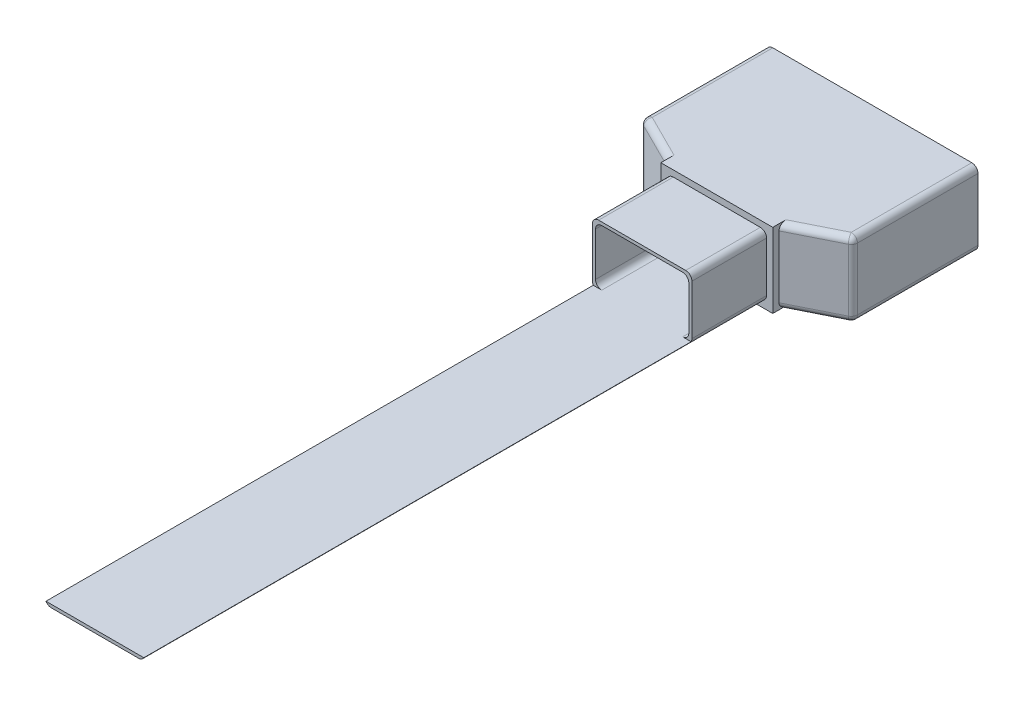
from build123d import *

# Parameters (mm, degrees)
CUT_EXTRUDE1_START         = -1.5875
CUT_EXTRUDE1_OUTLINE_W     = 53.975
CUT_EXTRUDE1_OUTLINE_H     = 19.05
CUT_EXTRUDE1_OUTLINE_W_2   = 50.8
CUT_EXTRUDE1_OUTLINE_H_2   = 15.875
CUT_EXTRUDE1_DEPTH         = 38.1
CUT_EXTRUDE1_START_2       = 30.1625
CUT_EXTRUDE1_2_DEPTH       = 166.6875
CUT_EXTRUDE1_3_DEPTH       = 6.35
CUT_EXTRUDE1_4_OUTLINE_W   = 50.8
CUT_EXTRUDE1_4_OUTLINE_H   = 15.875
CUT_EXTRUDE1_4_OUTLINE_W_2 = 7.9375
CUT_EXTRUDE1_4_OUTLINE_H_2 = 12.7
CUT_EXTRUDE1_4_DEPTH       = 1.5875
CUT_EXTRUDE1_5_DEPTH       = 26.9875
CUT_EXTRUDE1_6_OUTLINE_W   = 28.575
CUT_EXTRUDE1_6_OUTLINE_H   = 19.05
CUT_EXTRUDE1_6_DEPTH       = 7.9375
CUT_EXTRUDE1_START_3       = 2.38125
CUT_EXTRUDE1_7_DEPTH       = 14.2875
CUT_EXTRUDE1_8_DEPTH       = 19.05
SKETCH2_W                  = 8.89
SKETCH2_H                  = 2.5908
CUT_EXTRUDE2_DEPTH         = 203.030816028
SKETCH3_W                  = 1.9812
SKETCH3_H                  = 2.9972
CUT_EXTRUDE3_DEPTH         = 203.030816028
FILLET1_R                  = 1.5875
HOLE1_D                    = 6.35
HOLE1_DEPTH                = 1.5875


with BuildPart() as part:
    # Cut-Extrude1: read off the stored shape, not the designer's step
    # Cut-Extrude1 outline → Cut-Extrude1 (new body)
    with BuildSketch(Plane.XY.offset(-36.5125).offset(CUT_EXTRUDE1_START)):
        with Locations((14.2875, 9.525)):
            Rectangle(CUT_EXTRUDE1_OUTLINE_W, CUT_EXTRUDE1_OUTLINE_H)
        with Locations((14.2875, 9.525)):
            Rectangle(CUT_EXTRUDE1_OUTLINE_W_2, CUT_EXTRUDE1_OUTLINE_H_2, mode=Mode.SUBTRACT)
    extrude(amount=CUT_EXTRUDE1_DEPTH)

    # Cut-Extrude1 2 outline → Cut-Extrude1 2 (add)
    with BuildSketch(Plane.XY.offset(-36.5125).offset(CUT_EXTRUDE1_START_2)):
        with BuildLine():
            Line((3.175, 1.5875), (25.4, 1.5875))
            ThreePointArc((25.4, 1.5875), (26.19375, 1.800184672), (26.774815328, 2.38125))
            Line((26.774815328, 2.38125), (1.800184672, 2.38125))
            ThreePointArc((1.800184672, 2.38125), (2.38125, 1.800184672), (3.175, 1.5875))
        make_face()
    extrude(amount=CUT_EXTRUDE1_2_DEPTH)

    # Cut-Extrude1 3 outline → Cut-Extrude1 3 (add)
    with BuildSketch(Plane.XY.offset(-36.5125).offset(CUT_EXTRUDE1_START_2)):
        with BuildLine():
            Line((25.4, 1.5875), (39.6875, 1.5875))
            Line((39.6875, 1.5875), (39.6875, 17.4625))
            Line((39.6875, 17.4625), (-11.1125, 17.4625))
            Line((-11.1125, 17.4625), (-11.1125, 1.5875))
            Line((-11.1125, 1.5875), (3.175, 1.5875))
            ThreePointArc((3.175, 1.5875), (2.38125, 1.800184672), (1.800184672, 2.38125))
            Line((1.800184672, 2.38125), (3.96875, 2.38125))
            ThreePointArc((3.96875, 2.38125), (2.846217985, 2.846217985), (2.38125, 3.96875))
            Line((2.38125, 3.96875), (2.38125, 15.08125))
            ThreePointArc((2.38125, 15.08125), (2.846217985, 16.203782015), (3.96875, 16.66875))
            Line((3.96875, 16.66875), (24.60625, 16.66875))
            ThreePointArc((24.60625, 16.66875), (25.728782015, 16.203782015), (26.19375, 15.08125))
            Line((26.19375, 15.08125), (26.19375, 3.96875))
            ThreePointArc((26.19375, 3.96875), (25.728782015, 2.846217985), (24.60625, 2.38125))
            Line((24.60625, 2.38125), (26.774815328, 2.38125))
            ThreePointArc((26.774815328, 2.38125), (26.19375, 1.800184672), (25.4, 1.5875))
        make_face()
    extrude(amount=CUT_EXTRUDE1_3_DEPTH)

    # Cut-Extrude1 4 outline → Cut-Extrude1 4 (add)
    with BuildSketch(Plane.XY.offset(-36.5125).offset(CUT_EXTRUDE1_START)):
        with Locations((14.2875, 9.525)):
            Rectangle(CUT_EXTRUDE1_4_OUTLINE_W, CUT_EXTRUDE1_4_OUTLINE_H)
        with Locations((30.1625, 9.525)):
            Rectangle(CUT_EXTRUDE1_4_OUTLINE_W_2, CUT_EXTRUDE1_4_OUTLINE_H_2, mode=Mode.SUBTRACT)
    extrude(amount=CUT_EXTRUDE1_4_DEPTH)

    # Cut-Extrude1 5 outline → Cut-Extrude1 5 (add)
    with BuildSketch(Plane.XY.offset(-36.5125).offset(CUT_EXTRUDE1_START_2)):
        with BuildLine():
            Line((25.4, 17.4625), (3.175, 17.4625))
            ThreePointArc((3.175, 17.4625), (2.052467985, 16.997532015), (1.5875, 15.875))
            Line((1.5875, 15.875), (1.5875, 3.175))
            ThreePointArc((1.5875, 3.175), (1.641592751, 2.764124766), (1.800184672, 2.38125))
            Line((1.800184672, 2.38125), (3.96875, 2.38125))
            ThreePointArc((3.96875, 2.38125), (2.846217985, 2.846217985), (2.38125, 3.96875))
            Line((2.38125, 3.96875), (2.38125, 15.08125))
            ThreePointArc((2.38125, 15.08125), (2.846217985, 16.203782015), (3.96875, 16.66875))
            Line((3.96875, 16.66875), (24.60625, 16.66875))
            ThreePointArc((24.60625, 16.66875), (25.728782015, 16.203782015), (26.19375, 15.08125))
            Line((26.19375, 15.08125), (26.19375, 3.96875))
            ThreePointArc((26.19375, 3.96875), (25.728782015, 2.846217985), (24.60625, 2.38125))
            Line((24.60625, 2.38125), (26.774815328, 2.38125))
            ThreePointArc((26.774815328, 2.38125), (26.933407249, 2.764124766), (26.9875, 3.175))
            Line((26.9875, 3.175), (26.9875, 15.875))
            ThreePointArc((26.9875, 15.875), (26.522532015, 16.997532015), (25.4, 17.4625))
        make_face()
    extrude(amount=CUT_EXTRUDE1_5_DEPTH)

    # Cut-Extrude1 6 outline → Cut-Extrude1 6 (add)
    with BuildSketch(Plane.XY.offset(-36.5125).offset(CUT_EXTRUDE1_START_2)):
        with Locations((14.2875, 9.525)):
            Rectangle(CUT_EXTRUDE1_6_OUTLINE_W, CUT_EXTRUDE1_6_OUTLINE_H)
        with BuildLine():
            Line((25.4, 1.5875), (3.175, 1.5875))
            ThreePointArc((3.175, 1.5875), (2.052467985, 2.052467985), (1.5875, 3.175))
            Line((1.5875, 3.175), (1.5875, 15.875))
            ThreePointArc((1.5875, 15.875), (2.052467985, 16.997532015), (3.175, 17.4625))
            Line((3.175, 17.4625), (25.4, 17.4625))
            ThreePointArc((25.4, 17.4625), (26.522532015, 16.997532015), (26.9875, 15.875))
            Line((26.9875, 15.875), (26.9875, 3.175))
            ThreePointArc((26.9875, 3.175), (26.522532015, 2.052467985), (25.4, 1.5875))
        make_face(mode=Mode.SUBTRACT)
    extrude(amount=CUT_EXTRUDE1_6_DEPTH)

    # Cut-Extrude1 7 outline → Cut-Extrude1 7 (cut)
    with BuildSketch(Plane(origin=(0, 0, 0), x_dir=(1, 0, 0), z_dir=(0, 1, 0)).offset(CUT_EXTRUDE1_START_3)):
        Polygon((41.275, 6.35), (28.575, 0), (41.275, 0), align=None)
        Polygon((38.89375, 6.35), (-10.31875, 6.35), (6.38125, -2), (22.19375, -2), align=None)
        Polygon((0, 0), (-12.7, 6.35), (-12.7, 0), align=None)
    extrude(amount=CUT_EXTRUDE1_7_DEPTH, mode=Mode.SUBTRACT)

    # Cut-Extrude1 8 outline → Cut-Extrude1 8 (cut)
    with BuildSketch(Plane(origin=(0, 0, 0), x_dir=(1, 0, 0), z_dir=(0, 1, 0))):
        Polygon((41.275, 6.35), (28.575, 0), (41.275, 0), align=None)
        Polygon((0, 0), (-12.7, 6.35), (-12.7, 0), align=None)
    extrude(amount=CUT_EXTRUDE1_8_DEPTH, mode=Mode.SUBTRACT)

    # Sketch2 → Cut-Extrude2 (cut, through all)
    with BuildSketch(Plane.XY.offset(-36.5125)):
        with Locations((14.2875, 4.146252538)):
            Rectangle(SKETCH2_W, SKETCH2_H)
    extrude(amount=-CUT_EXTRUDE2_DEPTH, mode=Mode.SUBTRACT)

    # Sketch3 → Cut-Extrude3 (cut, through all)
    with BuildSketch(Plane.XY.offset(-36.5125)):
        with Locations((17.7419, 8.921452538)):
            Rectangle(SKETCH3_W, SKETCH3_H)
    extrude(amount=-CUT_EXTRUDE3_DEPTH, mode=Mode.SUBTRACT)

    # Fillet1
    fillet1_edges = [part.edges().sort_by_distance(p)[0] for p in [
        (-6.35, 0, -3.175),
        (-12.7, 0, -22.225),
        (-6.35, 19.05, -3.175),
        (-12.7, 9.525, -6.35),
        (-12.7, 19.05, -22.225),
        (41.275, 0, -22.225),
        (34.925, 0, -3.175),
        (41.275, 9.525, -6.35),
        (34.925, 19.05, -3.175),
        (41.275, 19.05, -22.225),
    ]]
    fillet(fillet1_edges, radius=FILLET1_R)

    # Hole1
    with Locations(Plane.XY.offset(-36.5125)):
        with Locations((-1.5875, 9.525)):
            Hole(HOLE1_D / 2, depth=HOLE1_DEPTH)


solid = part.part
